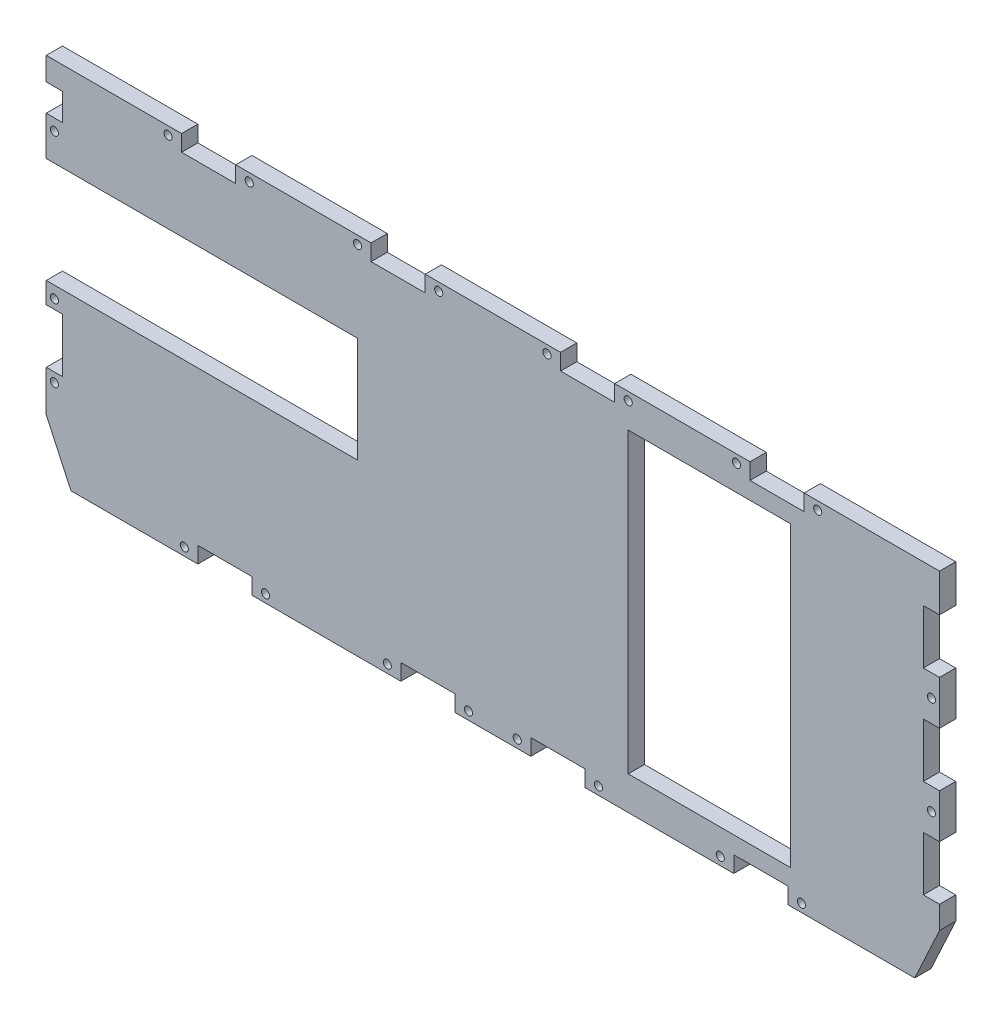
from build123d import *

# Parameters (mm, degrees)
BOSS_EXTRU_1_DEPTH      = 6
ESQUISSE3_W             = 6
ESQUISSE3_H             = 20
ESQUISSE3_H_2           = 10
ESQUISSE3_W_2           = 20
ESQUISSE3_H_3           = 6
ESQUISSE3_W_3           = 60
ESQUISSE3_H_4           = 110
ESQUISSE3_W_4           = 115
ESQUISSE3_H_5           = 39
ENL_V_MAT_EXTRU_2_DEPTH = 6
ESQUISSE4_R             = 1.5
ENL_V_MAT_EXTRU_3_DEPTH = 6
ESQUISSE5_W             = 456.045253014
ESQUISSE5_H             = 136.228984631
ENL_V_MAT_EXTRU_4_DEPTH = 6


with BuildPart() as part:
    # Esquisse1 → Boss.-Extru.1 (new body)
    with BuildSketch(Plane.XY):
        Polygon((-165, 96.73), (165, 96.73), (165, -18.27), (123, -109.022410436), (-123, -109.022410436), (-165, -18.27), align=None)
    extrude(amount=BOSS_EXTRU_1_DEPTH)

    # Esquisse3 → Enlèv. mat.-Extru.2 (cut)
    with BuildSketch(Plane(origin=(0, 0, 0), x_dir=(-1, 0, 0), z_dir=(0, 0, -1))):
        with Locations((162, 6.94)):
            Rectangle(ESQUISSE3_W, ESQUISSE3_H)
        with Locations((162, 83.23258956)):
            Rectangle(ESQUISSE3_W, ESQUISSE3_H_2)
        with Locations((-24, -35.02)):
            Rectangle(ESQUISSE3_W_2, ESQUISSE3_H_3)
        with Locations((99, -35.02)):
            Rectangle(ESQUISSE3_W_2, ESQUISSE3_H_3)
        with Locations((-80, 29.355)):
            Rectangle(ESQUISSE3_W_3, ESQUISSE3_H_4)
        with Locations((-162, 72.73)):
            Rectangle(ESQUISSE3_W, ESQUISSE3_H)
        with Locations((24, -35.02)):
            Rectangle(ESQUISSE3_W_2, ESQUISSE3_H_3)
        with Locations((-162, 36.44)):
            Rectangle(ESQUISSE3_W, ESQUISSE3_H)
        with Locations((-162, 0.15)):
            Rectangle(ESQUISSE3_W, ESQUISSE3_H)
        with Locations((105, 93.73)):
            Rectangle(ESQUISSE3_W_2, ESQUISSE3_H_3)
        with Locations((-35, 93.73)):
            Rectangle(ESQUISSE3_W_2, ESQUISSE3_H_3)
        with Locations((35, 93.73)):
            Rectangle(ESQUISSE3_W_2, ESQUISSE3_H_3)
        with Locations((-105, 93.73)):
            Rectangle(ESQUISSE3_W_2, ESQUISSE3_H_3)
        with Locations((107.5, 44.23)):
            Rectangle(ESQUISSE3_W_4, ESQUISSE3_H_5)
        with Locations((-99, -35.02)):
            Rectangle(ESQUISSE3_W_2, ESQUISSE3_H_3)
    extrude(amount=-ENL_V_MAT_EXTRU_2_DEPTH, mode=Mode.SUBTRACT)

    # Esquisse4 → Enlèv. mat.-Extru.3 (cut)
    with BuildSketch(Plane(origin=(0, 0, 0), x_dir=(-1, 0, 0), z_dir=(0, 0, -1))):
        with Locations((162, 20.335)):
            Circle(ESQUISSE4_R)
        with Locations((114, -35.02)):
            Circle(ESQUISSE4_R)
        with Locations((162, 73.98258956)):
            Circle(ESQUISSE4_R)
        with Locations((84, -35.02)):
            Circle(ESQUISSE4_R)
        with Locations((39, -35.02)):
            Circle(ESQUISSE4_R)
        with Locations((162, -6.46)):
            Circle(ESQUISSE4_R)
        with Locations((9, -35.02)):
            Circle(ESQUISSE4_R)
        with Locations((-9, -35.02)):
            Circle(ESQUISSE4_R)
        with Locations((-39, -35.02)):
            Circle(ESQUISSE4_R)
        with Locations((-84, -35.02)):
            Circle(ESQUISSE4_R)
        with Locations((120, 93.73)):
            Circle(ESQUISSE4_R)
        with Locations((-114, -35.02)):
            Circle(ESQUISSE4_R)
        with Locations((90, 93.73)):
            Circle(ESQUISSE4_R)
        with Locations((50, 93.73)):
            Circle(ESQUISSE4_R)
        with Locations((20, 93.73)):
            Circle(ESQUISSE4_R)
        with Locations((-162, 18.29)):
            Circle(ESQUISSE4_R)
        with Locations((-162, 54.585)):
            Circle(ESQUISSE4_R)
        with Locations((-20, 93.73)):
            Circle(ESQUISSE4_R)
        with Locations((-50, 93.73)):
            Circle(ESQUISSE4_R)
        with Locations((-90, 93.73)):
            Circle(ESQUISSE4_R)
        with Locations((-120, 93.73)):
            Circle(ESQUISSE4_R)
    extrude(amount=-ENL_V_MAT_EXTRU_3_DEPTH, mode=Mode.SUBTRACT)

    # Esquisse5 → Enlèv. mat.-Extru.4 (cut)
    with BuildSketch(Plane(origin=(0, 0, 0), x_dir=(-1, 0, 0), z_dir=(0, 0, -1))):
        with Locations((-18.307092018, -106.134492316)):
            Rectangle(ESQUISSE5_W, ESQUISSE5_H)
    extrude(amount=-ENL_V_MAT_EXTRU_4_DEPTH, mode=Mode.SUBTRACT)


solid = part.part
